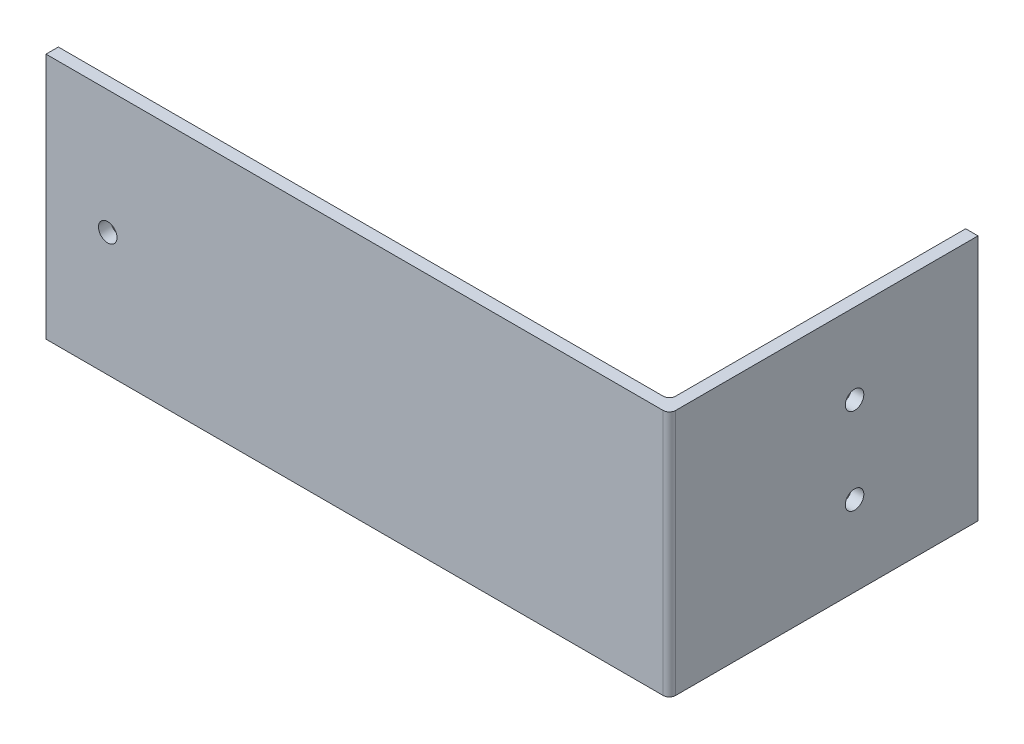
from build123d import *

# Parameters (mm, degrees)
SKETCH1_W           = 100
SKETCH1_H           = 40
SKETCH1_R           = 1.5
BOSS_EXTRUDE1_DEPTH = 2
SKETCH2_W           = 2
SKETCH2_H           = 40
BOSS_EXTRUDE3_DEPTH = 50
FILLET2_R           = 1
SKETCH3_R           = 1.5
CUT_EXTRUDE1_DEPTH  = 10


with BuildPart() as part:
    # Sketch1 → Boss-Extrude1 (new body)
    with BuildSketch(Plane.XY):
        with Locations((50, 20)):
            Rectangle(SKETCH1_W, SKETCH1_H)
        with Locations((10, 20)):
            Circle(SKETCH1_R, mode=Mode.SUBTRACT)
    extrude(amount=BOSS_EXTRUDE1_DEPTH)

    # Sketch2 → Boss-Extrude3 (add)
    with BuildSketch(Plane.XY.offset(2)):
        with Locations((100, 20)):
            Rectangle(SKETCH2_W, SKETCH2_H)
    extrude(amount=-BOSS_EXTRUDE3_DEPTH)

    # Fillet2
    fillet2_edges = [part.edges().sort_by_distance(p)[0] for p in [
        (101, 20, 2),
        (99, 20, 0),
    ]]
    fillet(fillet2_edges, radius=FILLET2_R)

    # Sketch3 → Cut-Extrude1 (cut)
    with BuildSketch(Plane(origin=(101, 0, 0), x_dir=(0, 0, -1), z_dir=(1, 0, 0))):
        with Locations((28, 13)):
            Circle(SKETCH3_R)
        with Locations((28, 27)):
            Circle(SKETCH3_R)
    extrude(amount=-CUT_EXTRUDE1_DEPTH, mode=Mode.SUBTRACT)


solid = part.part
